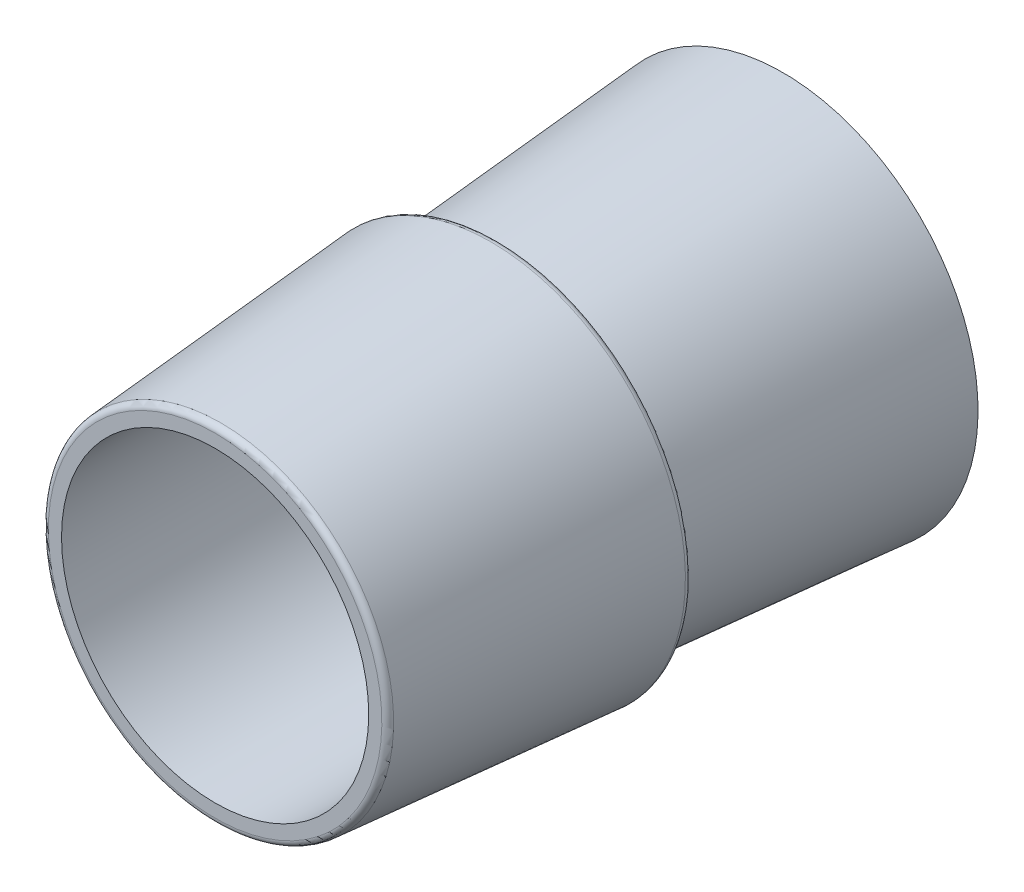
from build123d import *

# Parameters (mm, degrees)
SKETCH3_R          = 2.5
CUT_EXTRUDE1_DEPTH = 11.870964041
FILLET1_R          = 0.1


with BuildPart() as part:
    # Sketch2 → Revolve2 (revolve)
    with BuildSketch(Plane(origin=(0, 0, 0), x_dir=(0, 0, -1), z_dir=(1, 0, 0))):
        Polygon((-0.677185359, 1.218766529), (-0.677185359, -1.587300884), (8.565327607, -1.587300884), (8.565327607, 1.587300884), (4.018530536, 1.226381703), (3.922595891, 1.218766529), (3.922595891, 1.583891529), (-0.581250714, 1.226381703), align=None)
    revolve(axis=Axis((0, -1.587300884, 0.677185359), (0, 0, -1)))

    # Sketch3 → Cut-Extrude1 (cut, through all)
    with BuildSketch(Plane(origin=(0, 0, -8.565327607), x_dir=(-1, 0, 0), z_dir=(0, 0, -1))):
        with Locations((0, -1.587300884)):
            Circle(SKETCH3_R)
    extrude(amount=-CUT_EXTRUDE1_DEPTH, mode=Mode.SUBTRACT)

    # Fillet1
    fillet1_edges = [part.edges().sort_by_distance(p)[0] for p in [
        (0, -4.758493297, -3.922595891),
        (0, -4.393368297, 0.677185359),
    ]]
    fillet(fillet1_edges, radius=FILLET1_R)


solid = part.part
